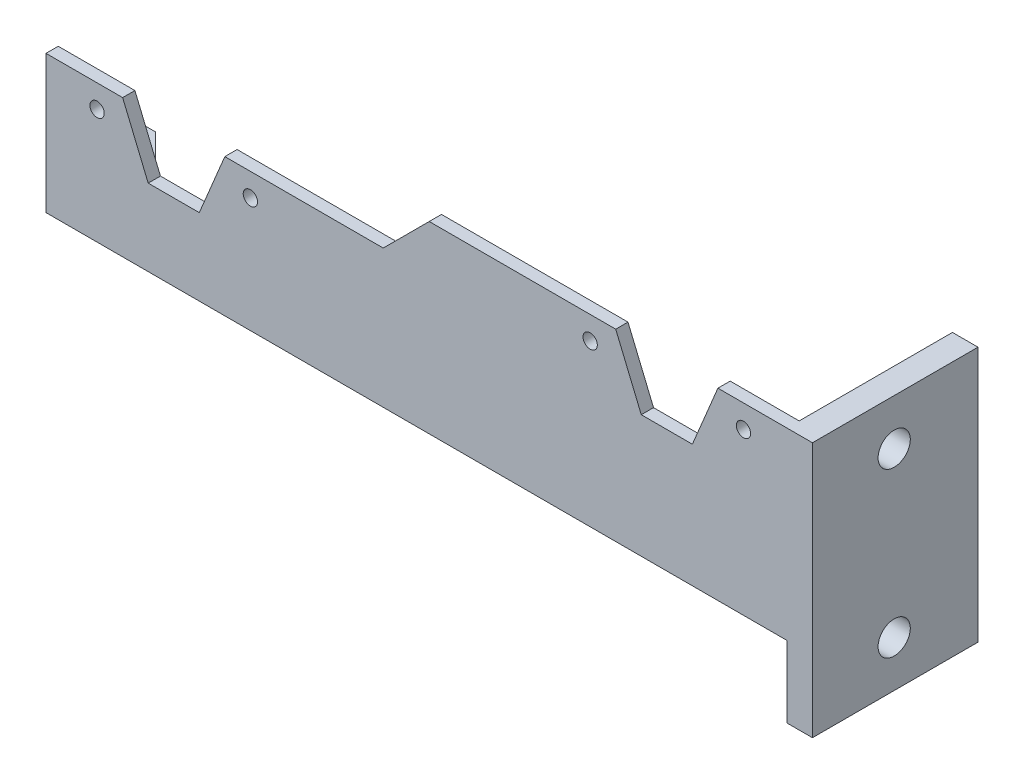
from build123d import *

# Parameters (mm, degrees)
SKETCH1_W                       = 150
SKETCH1_H                       = 36
BOSS_EXTRUDE1_DEPTH             = 2.4
SKETCH10_W                      = 75
SKETCH10_H                      = 9
CUT_EXTRUDE5_DEPTH              = 10
SKETCH2_R                       = 1.4
CUT_EXTRUDE1_DEPTH              = 155.278190293
CHAMFER6_SIZE                   = 9
SKETCH3_W                       = 5
SKETCH3_H                       = 50
BOSS_EXTRUDE2_DEPTH             = 30
BOSS_EXTRUDE2_DIRECTION_2_REACH = 156.278
SKETCH4_R                       = 3.15
CUT_EXTRUDE2_DEPTH              = 30
SKETCH8_W                       = 10
SKETCH8_H                       = 2
BOSS_EXTRUDE4_DEPTH             = 145
SKETCH9_W                       = 20
SKETCH9_H                       = 12.540874848
SKETCH9_H_2                     = 13.006860614
CUT_EXTRUDE4_DEPTH              = 161.934769394
CHAMFER5_SIZE                   = 6


with BuildPart() as part:
    # Sketch1 → Boss-Extrude1 (new body)
    with BuildSketch(Plane.XY):
        with Locations((75, 18)):
            Rectangle(SKETCH1_W, SKETCH1_H)
    extrude(amount=BOSS_EXTRUDE1_DEPTH)

    # Sketch10 → Cut-Extrude5 (cut)
    with BuildSketch(Plane.XY.offset(2.4)):
        with Locations((37.5, 31.5)):
            Rectangle(SKETCH10_W, SKETCH10_H)
    extrude(amount=-CUT_EXTRUDE5_DEPTH, mode=Mode.SUBTRACT)

    # Sketch2 → Cut-Extrude1 (cut, through all)
    with BuildSketch(Plane.XY.offset(2.4)):
        with Locations((40, 22.5)):
            Circle(SKETCH2_R)
        with Locations(Location((10, 22.5, 0), (0, 0, 180))):
            Circle(SKETCH2_R)
        with Locations(Location((106.5, 31.5, 0), (0, 0, 180))):
            Circle(SKETCH2_R)
        with Locations((136.5, 31.5)):
            Circle(SKETCH2_R)
        Polygon((131.5, 36), (126.5, 24), (116.5, 24), (111.5, 36), align=None)
        Polygon((35, 27), (30, 15), (20, 15), (15, 27), align=None)
    extrude(amount=-CUT_EXTRUDE1_DEPTH, mode=Mode.SUBTRACT)

    # Chamfer6
    chamfer6_edges = [part.edges().sort_by_distance(p)[0] for p in [
        (75, 27, 1.2),
    ]]
    chamfer(chamfer6_edges, length=CHAMFER6_SIZE - 0.0001)  # a hair under: the kernel refuses the full size

    # Sketch3 → Boss-Extrude2 (add)
    with BuildSketch(Plane(origin=(0, 0, 0), x_dir=(-1, 0, 0), z_dir=(0, 0, -1))):
        with Locations((-147.5, 11)):
            Rectangle(SKETCH3_W, SKETCH3_H)
    extrude(amount=BOSS_EXTRUDE2_DEPTH)

    # Boss-Extrude2 direction 2: up to this face of the body (flat: up to its plane)
    boss_extrude2_direction_2_end = Plane(part.part.faces().sort_by_distance((80.903875834, 15.309167909, 2.4))[0])
    # Sketch3 → Boss-Extrude2 direction 2 (add, up to the picked face)
    with BuildSketch(Plane(origin=(0, 0, 0), x_dir=(-1, 0, 0), z_dir=(0, 0, -1)), mode=Mode.PRIVATE) as boss_extrude2_direction_2_sk1:
        with Locations((-147.5, 11)):
            Rectangle(SKETCH3_W, SKETCH3_H)
    boss_extrude2_direction_2_tool1 = split(extrude(boss_extrude2_direction_2_sk1.sketch, amount=-BOSS_EXTRUDE2_DIRECTION_2_REACH, mode=Mode.PRIVATE), bisect_by=boss_extrude2_direction_2_end, keep=Keep.BOTH, mode=Mode.PRIVATE)
    add(boss_extrude2_direction_2_tool1.solids().sort_by(Axis((147.5, 11, 0), (0, 0, 1)))[0])

    # Sketch4 → Cut-Extrude2 (cut)
    with BuildSketch(Plane.ZY.offset(-145)):
        with Locations((-13.6, 27)):
            Circle(SKETCH4_R)
        with Locations((-13.6, -5)):
            Circle(SKETCH4_R)
    extrude(amount=-CUT_EXTRUDE2_DEPTH, mode=Mode.SUBTRACT)

    # Sketch8 → Boss-Extrude4 (add)
    with BuildSketch(Plane.ZY.offset(-145)):
        with Locations((-5, 11)):
            Rectangle(SKETCH8_W, SKETCH8_H)
    extrude(amount=BOSS_EXTRUDE4_DEPTH)

    # Sketch9 → Cut-Extrude4 (cut, through all)
    with BuildSketch(Plane(origin=(0, 36, 0), x_dir=(1, 0, 0), z_dir=(0, 1, 0))):
        with Locations((121.5, 6.270437424)):
            Rectangle(SKETCH9_W, SKETCH9_H)
        with Locations((25, 6.503430307)):
            Rectangle(SKETCH9_W, SKETCH9_H_2)
    extrude(amount=-CUT_EXTRUDE4_DEPTH, mode=Mode.SUBTRACT)

    # Chamfer5
    chamfer5_edges = [part.edges().sort_by_distance(p)[0] for p in [
        (0, 11, -10),
        (111.5, 11, -10),
        (131.5, 11, -10),
        (15, 11, -10),
        (35, 11, -10),
    ]]
    chamfer(chamfer5_edges, length=CHAMFER5_SIZE)


solid = part.part
